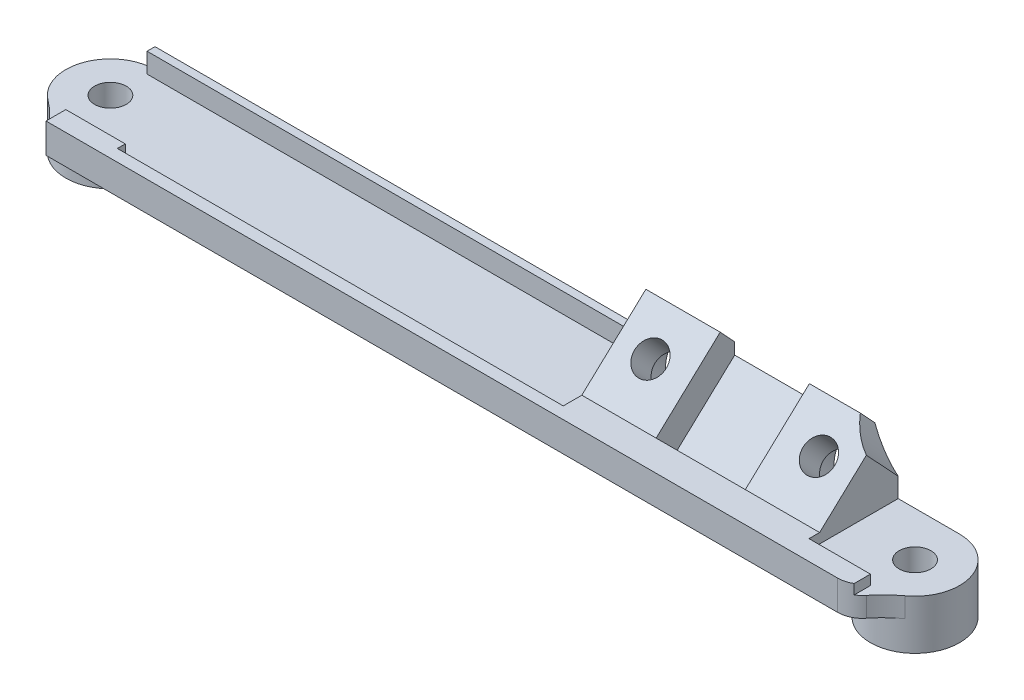
from build123d import *

# Parameters (mm, degrees)
SKETCH_1_R                  = 4.5
SKETCH_1_R_2                = 1.6
EXTRUDE_1_DEPTH             = 3
SKETCH_2_R                  = 1.6
EXTRUDE_2_DEPTH             = 2
EXTRUDE_3_DEPTH             = 24
CUT_EXTRUDE_1_REACH         = 88.596
SKETCH_4_R                  = 1.6
SKETCH_6_W                  = 9
SKETCH_6_H                  = 13.66994387
CUT_EXTRUDE_2_DEPTH         = 3
CUT_EXTRUDE_3_REACH         = 88.648
SKETCH_7_R                  = 3
EXTRUDE_START               = 3
SKETCH_8_R                  = 4.5
SKETCH_8_R_2                = 1.6
EXTRUDE_4_DEPTH             = 3
CUT_EXTRUDE_4_REACH         = 88.596
SKETCH_9_R                  = 6
SKETCH_10_W                 = 51
SKETCH_10_H                 = 0.8
EXTRUDE_5_DEPTH             = 2
SKETCH_11_W                 = 81.2
SKETCH_11_H                 = 2
EXTRUDE_6_DEPTH             = 1
EXTRUDE_6_DIRECTION_2_REACH = 88.227
FILLET_1_R                  = 10
CUT_EXTRUDE_5_REACH         = 88.355
SKETCH_12_W                 = 45
SKETCH_12_H                 = 0.8
EXTRUDE_7_DEPTH             = 24
EXTRUDE_8_DEPTH             = 9
CUT_EXTRUDE_START           = -2.144737
SKETCH_15_W                 = 21.643481228
SKETCH_15_H                 = 2
CUT_EXTRUDE_6_DEPTH         = 2.144737
CUT_EXTRUDE_7_REACH         = 88.157


with BuildPart() as part:
    # 草图1 → 凸台-拉伸1 (new body)
    with BuildSketch(Plane(origin=(0, 0, 0), x_dir=(1, 0, 0), z_dir=(0, 1, 0))):
        with Locations(Location((0, 0, 0), (0, 0, 270))):
            Circle(SKETCH_1_R)
        with Locations(Location((0, 0, 0), (0, 0, 270))):
            Circle(SKETCH_1_R_2, mode=Mode.SUBTRACT)
    extrude(amount=EXTRUDE_1_DEPTH)

    # 草图2 → 凸台-拉伸2 (add)
    with BuildSketch(Plane(origin=(0, 3, 0), x_dir=(1, 0, 0), z_dir=(0, 1, 0))):
        with BuildLine():
            Line((0, 4.5), (81.2, 4.5))
            ThreePointArc((81.2, 4.5), (85.7, 0), (81.2, -4.5))
            Line((81.2, -4.5), (0, -4.5))
            ThreePointArc((0, -4.5), (-4.5, 0), (0, 4.5))
        make_face()
        with Locations(Location((81.2, 0, 0), (0, 0, 270))):
            Circle(SKETCH_2_R, mode=Mode.SUBTRACT)
        with Locations(Location((0, 0, 0), (0, 0, 270))):
            Circle(SKETCH_2_R, mode=Mode.SUBTRACT)
    extrude(amount=EXTRUDE_2_DEPTH)

    # 草图3 → 凸台-拉伸3 (add)
    with BuildSketch(Plane(origin=(75, 0, 0), x_dir=(0, 0, -1), z_dir=(1, 0, 0))):
        Polygon((-4.5, 5), (4.5, 13.392635775), (4.5, 5), align=None)
    extrude(amount=-EXTRUDE_3_DEPTH)

    # 草图4 → 切除-拉伸1 (cut, up to next)
    with BuildSketch(Plane(origin=(0, 4.918910297, 4.58695806), x_dir=(1, 0, 0), z_dir=(0, 0.7313537016191739, 0.6819983600624948)), mode=Mode.PRIVATE) as cut_extrude_1_sk1:
        with Locations(Location((54.5, 6.271873718, 0), (0, 0, 270))):
            Circle(SKETCH_4_R)
    cut_extrude_1_tool1 = extrude(cut_extrude_1_sk1.sketch, amount=-CUT_EXTRUDE_1_REACH, mode=Mode.PRIVATE) & part.part
    # 草图4 → 切除-拉伸1 (cut, up to next)
    with BuildSketch(Plane(origin=(0, 4.918910297, 4.58695806), x_dir=(1, 0, 0), z_dir=(0, 0.7313537016191739, 0.6819983600624948)), mode=Mode.PRIVATE) as cut_extrude_1_sk2:
        with Locations(Location((71.5, 6.271873718, 0), (0, 0, 270))):
            Circle(SKETCH_4_R)
    cut_extrude_1_tool2 = extrude(cut_extrude_1_sk2.sketch, amount=-CUT_EXTRUDE_1_REACH, mode=Mode.PRIVATE) & part.part
    add(cut_extrude_1_tool1.solids().sort_by_distance((54.5, 9.196318, 0))[0], mode=Mode.SUBTRACT)
    add(cut_extrude_1_tool2.solids().sort_by_distance((71.5, 9.196318, 0))[0], mode=Mode.SUBTRACT)

    # 草图6 → 切除-拉伸2 (cut)
    with BuildSketch(Plane(origin=(0, 4.918910297, 4.58695806), x_dir=(1, 0, 0), z_dir=(0, 0.7313537016191739, 0.6819983600624948))):
        with Locations((63, 5.589875358)):
            Rectangle(SKETCH_6_W, SKETCH_6_H)
    extrude(amount=-CUT_EXTRUDE_2_DEPTH, mode=Mode.SUBTRACT)

    # 草图7 → 切除-拉伸3 (cut, up to next)
    with BuildSketch(Plane(origin=(0, 2.724849193, 2.54096298), x_dir=(1, 0, 0), z_dir=(0, 0.7313537016191739, 0.6819983600624948)), mode=Mode.PRIVATE) as cut_extrude_3_sk1:
        with Locations(Location((54.5, 6.271873718, 0), (0, 0, 270))):
            Circle(SKETCH_7_R)
    cut_extrude_3_tool1 = extrude(cut_extrude_3_sk1.sketch, amount=-CUT_EXTRUDE_3_REACH, mode=Mode.PRIVATE) & part.part
    # 草图7 → 切除-拉伸3 (cut, up to next)
    with BuildSketch(Plane(origin=(0, 2.724849193, 2.54096298), x_dir=(1, 0, 0), z_dir=(0, 0.7313537016191739, 0.6819983600624948)), mode=Mode.PRIVATE) as cut_extrude_3_sk2:
        with Locations(Location((71.5, 6.271873718, 0), (0, 0, 270))):
            Circle(SKETCH_7_R)
    cut_extrude_3_tool2 = extrude(cut_extrude_3_sk2.sketch, amount=-CUT_EXTRUDE_3_REACH, mode=Mode.PRIVATE) & part.part
    add(cut_extrude_3_tool1.solids().sort_by_distance((54.5, 7.002257, -2.045995))[0], mode=Mode.SUBTRACT)
    add(cut_extrude_3_tool2.solids().sort_by_distance((71.5, 7.002257, -2.045995))[0], mode=Mode.SUBTRACT)

    # 草图8 → 凸台-拉伸4 (add)
    with BuildSketch(Plane.XZ.offset(-3).offset(EXTRUDE_START)):
        with Locations(Location((81.2, 0, 0), (0, 0, 90))):
            Circle(SKETCH_8_R)
        with Locations(Location((81.2, 0, 0), (0, 0, 90))):
            Circle(SKETCH_8_R_2, mode=Mode.SUBTRACT)
    extrude(amount=-EXTRUDE_4_DEPTH)

    # 草图9 → 切除-拉伸4 (cut, up to next)
    with BuildSketch(Plane(origin=(0, 4.918910297, 4.58695806), x_dir=(1, 0, 0), z_dir=(0, 0.7313537016191739, 0.6819983600624948)), mode=Mode.PRIVATE) as cut_extrude_4_sk1:
        with Locations((77.925, 13.271873718)):
            Circle(SKETCH_9_R)
    cut_extrude_4_tool1 = extrude(cut_extrude_4_sk1.sketch, amount=-CUT_EXTRUDE_4_REACH, mode=Mode.PRIVATE) & part.part
    add(cut_extrude_4_tool1.solids().sort_by_distance((77.925, 13.970306, -5.119476))[0], mode=Mode.SUBTRACT)

    # 草图10 → 凸台-拉伸5 (add)
    with BuildSketch(Plane(origin=(0, 5, 0), x_dir=(1, 0, 0), z_dir=(0, 1, 0))):
        with Locations((25.5, 4.1)):
            Rectangle(SKETCH_10_W, SKETCH_10_H)
    extrude(amount=EXTRUDE_5_DEPTH)

    # 草图11 → 凸台-拉伸6 (add)
    with BuildSketch(Plane(origin=(0, 5, 0), x_dir=(1, 0, 0), z_dir=(0, 1, 0))):
        with Locations((40.6, -5.5)):
            Rectangle(SKETCH_11_W, SKETCH_11_H)
    extrude(amount=EXTRUDE_6_DEPTH)

    # 凸台-拉伸6 direction 2: up to this face of the body (flat: up to its plane)
    extrude_6_direction_2_end = Plane(part.part.faces().sort_by_distance((39.023781637, 3, 0.016114568))[0])
    # 草图11 → 凸台-拉伸6 direction 2 (add, up to the picked face)
    with BuildSketch(Plane(origin=(0, 5, 0), x_dir=(1, 0, 0), z_dir=(0, 1, 0)), mode=Mode.PRIVATE) as extrude_6_direction_2_sk1:
        with Locations((40.6, -5.5)):
            Rectangle(SKETCH_11_W, SKETCH_11_H)
    extrude_6_direction_2_tool1 = split(extrude(extrude_6_direction_2_sk1.sketch, amount=-EXTRUDE_6_DIRECTION_2_REACH, mode=Mode.PRIVATE), bisect_by=extrude_6_direction_2_end, keep=Keep.BOTH, mode=Mode.PRIVATE)
    add(extrude_6_direction_2_tool1.solids().sort_by(Axis((40.6, 5, 5.5), (0, -1, 0)))[0])

    # 圆角1
    # the kernel refuses this fillet: 10 mm, written as the material it adds along each edge
    with BuildSketch(Plane(origin=(81.2, 3, 4.5), x_dir=(0.9510569298520609, 0, -0.30901572157476376), z_dir=(0, 1, 0))) as fillet_1_piece_1:
        with BuildLine():
            CenterArc((5.87129871, -9.510569299), FILLET_1_R, 107.999923321, 22.461280704)
            Line((-0.618031443, -1.90211386), (0, 0))
            ThreePointArc((0, 0), (1.390570747, -0.220243816), (2.781141494, 0))
        make_face()
    extrude(amount=2)
    with BuildSketch(Plane(origin=(0, 3, 4.5), x_dir=(-0.9510569298520611, 0, -0.3090157215747629), z_dir=(0, 1, 0))) as fillet_1_piece_2:
        with BuildLine():
            CenterArc((5.87129871, 9.510569299), FILLET_1_R, 229.538795975, 22.461280704)
            Line((-0.618031443, 1.90211386), (0, 0))
            ThreePointArc((0, 0), (1.390570747, 0.220243816), (2.781141494, 0))
        make_face()
    extrude(amount=2)

    # 草图12 → 切除-拉伸5 (cut, up to next)
    with BuildSketch(Plane(origin=(0, 5, 0), x_dir=(1, 0, 0), z_dir=(0, 1, 0)), mode=Mode.PRIVATE) as cut_extrude_5_sk1:
        with Locations((28.5, -4.9)):
            Rectangle(SKETCH_12_W, SKETCH_12_H)
    cut_extrude_5_tool1 = extrude(cut_extrude_5_sk1.sketch, amount=CUT_EXTRUDE_5_REACH, mode=Mode.PRIVATE) & part.part
    add(cut_extrude_5_tool1.solids().sort_by_distance((28.5, 5, 4.9))[0], mode=Mode.SUBTRACT)

    # 草图13 → 凸台-拉伸7 (add)
    with BuildSketch(Plane(origin=(75, 0, 0), x_dir=(0, 0, -1), z_dir=(1, 0, 0))):
        Polygon((-4.5, 6), (-3.42763129, 6), (-4.5, 5), align=None)
    extrude(amount=-EXTRUDE_7_DEPTH)

    # 草图14 → 凸台-拉伸8 (add)
    with BuildSketch(Plane(origin=(58.5, 0, 0), x_dir=(0, 0, -1), z_dir=(1, 0, 0))):
        Polygon((-3.42763129, 6), (-1.38163621, 3.805938895), (-2.245899863, 3), (-4.5, 3), (-4.5, 5), align=None)
    extrude(amount=EXTRUDE_8_DEPTH)

    # 草图15 → 切除-拉伸6 (cut)
    with BuildSketch(Plane(origin=(0, 4.918910297, 4.58695806), x_dir=(1, 0, 0), z_dir=(0, 0.7313537016191739, 0.6819983600624948)).offset(CUT_EXTRUDE_START)):
        with Locations((61.821740614, 11.424847293)):
            Rectangle(SKETCH_15_W, SKETCH_15_H)
    extrude(amount=CUT_EXTRUDE_6_DEPTH, mode=Mode.SUBTRACT)

    # 草图16 → 切除-拉伸7 (cut, up to next)
    with BuildSketch(Plane(origin=(0, 6, 0), x_dir=(1, 0, 0), z_dir=(0, 1, 0)), mode=Mode.PRIVATE) as cut_extrude_7_sk1:
        with BuildLine():
            Line((79.900166375, -6.5), (81.2, -6.5))
            ThreePointArc((81.2, -6.5), (81.518478449, -6.013408883), (81.864704052, -5.546153846))
            ThreePointArc((81.864704052, -5.546153846), (80.992094803, -6.24893137), (79.900166375, -6.5))
        make_face()
    cut_extrude_7_tool1 = extrude(cut_extrude_7_sk1.sketch, amount=-CUT_EXTRUDE_7_REACH, mode=Mode.PRIVATE) & part.part
    add(cut_extrude_7_tool1.solids().sort_by_distance((81.054691, 6, 6.297183))[0], mode=Mode.SUBTRACT)


solid = part.part
